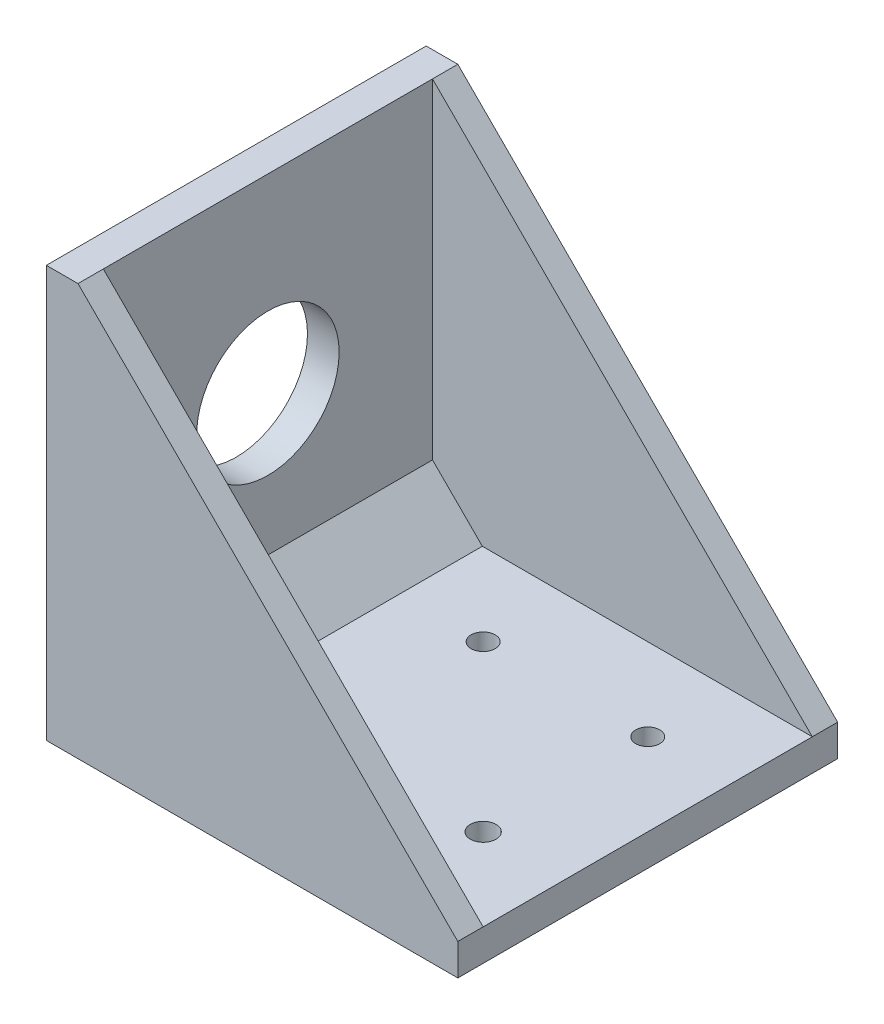
from build123d import *

# Parameters (mm, degrees)
SKETCH1_W           = 76.2
SKETCH1_H           = 6.35
BOSS_EXTRUDE1_DEPTH = 76.2
SKETCH1_3_W         = 76.2
SKETCH1_3_H         = 76.2
SKETCH1_3_R         = 14.2875
BOSS_EXTRUDE2_DEPTH = 6.35
SKETCH3_W           = 6.35
SKETCH3_H           = 76.2
BOSS_EXTRUDE3_DEPTH = 6.35
BOSS_EXTRUDE4_DEPTH = 5.08
BOSS_EXTRUDE5_DEPTH = 5.08
CHAMFER2_SIZE       = 10
SKETCH6_R           = 2.413
SKETCH6_R_2         = 2.5796875
CUT_EXTRUDE1_DEPTH  = 115.3


with BuildPart() as part:
    # Sketch1 → Boss-Extrude1 (new body)
    with BuildSketch(Plane(origin=(0, 0, 0), x_dir=(0, 0, -1), z_dir=(1, 0, 0))):
        with Locations((0, -41.275)):
            Rectangle(SKETCH1_W, SKETCH1_H)
    extrude(amount=BOSS_EXTRUDE1_DEPTH)



with BuildPart() as body_2:
    # Sketch1<3> → Boss-Extrude2 (new body)
    with BuildSketch(Plane(origin=(0, 0, 0), x_dir=(0, 0, -1), z_dir=(1, 0, 0))):
        Rectangle(SKETCH1_3_W, SKETCH1_3_H)
        Circle(SKETCH1_3_R, mode=Mode.SUBTRACT)
    extrude(amount=-BOSS_EXTRUDE2_DEPTH)


with BuildPart() as part_1:
    add(part.part)

    add(body_2.part)  # Boss-Extrude3 merges body 2
    # Sketch3 → Boss-Extrude3 (add)
    with BuildSketch(Plane.XZ.offset(38.1)):
        with Locations((-3.175, 0)):
            Rectangle(SKETCH3_W, SKETCH3_H)
    extrude(amount=BOSS_EXTRUDE3_DEPTH)

    # Sketch4 → Boss-Extrude4 (add)
    with BuildSketch(Plane.XY.offset(38.1)):
        Polygon((0, 38.1), (76.2, -38.1), (0, -38.1), align=None)
    extrude(amount=-BOSS_EXTRUDE4_DEPTH)

    # Sketch5 → Boss-Extrude5 (add)
    with BuildSketch(Plane(origin=(0, 0, -38.1), x_dir=(-1, 0, 0), z_dir=(0, 0, -1))):
        Polygon((0, 38.1), (-76.2, -38.1), (0, -38.1), align=None)
    extrude(amount=-BOSS_EXTRUDE5_DEPTH)

    # Chamfer2
    chamfer2_edges = [part_1.edges().sort_by_distance(p)[0] for p in [
        (0, -38.1, 0),
    ]]
    chamfer(chamfer2_edges, length=CHAMFER2_SIZE)

    # Sketch6 → Cut-Extrude1 (cut, through all)
    with BuildSketch(Plane(origin=(0, -38.1, 0), x_dir=(1, 0, 0), z_dir=(0, 1, 0))):
        with Locations((26.67, 16.51)):
            Circle(SKETCH6_R)
        with Locations((59.69, 16.51)):
            Circle(SKETCH6_R)
        with Locations((26.67, -16.51)):
            Circle(SKETCH6_R)
        with Locations((59.69, -16.51)):
            Circle(SKETCH6_R_2)
    extrude(amount=-CUT_EXTRUDE1_DEPTH, mode=Mode.SUBTRACT)


solid = part_1.part
